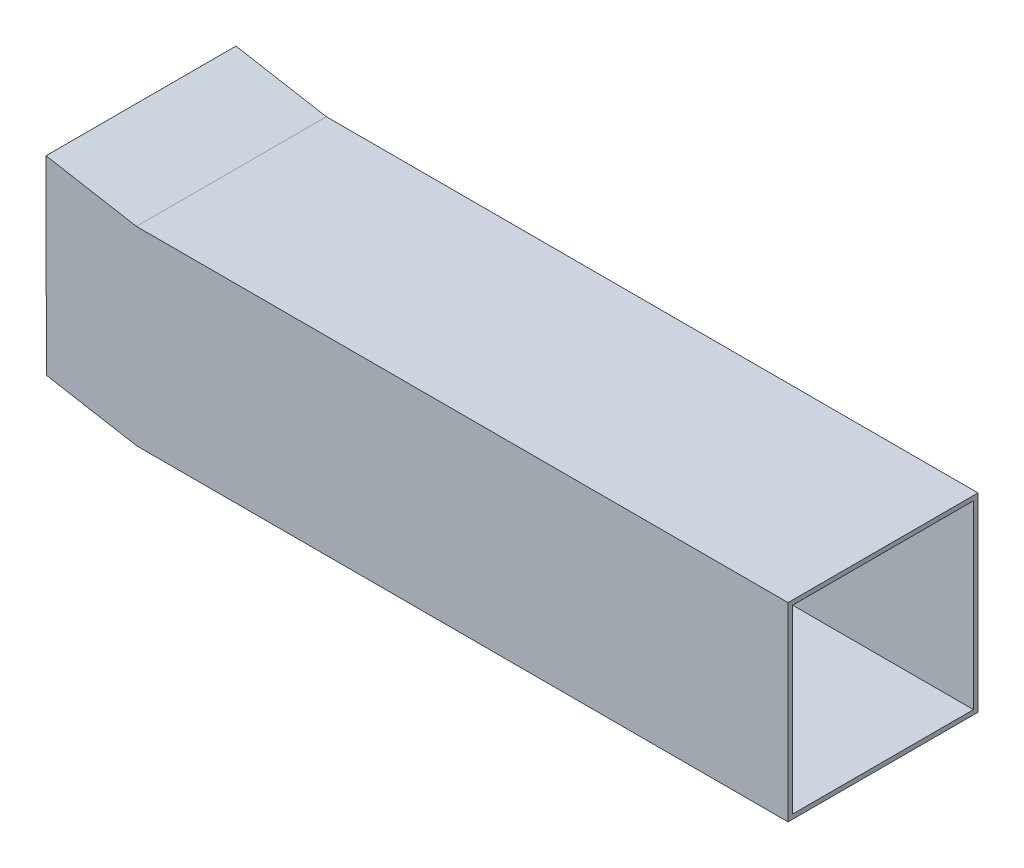
from build123d import *

# Parameters (mm, degrees)
SKETCH1_W           = 820
SKETCH1_H           = 210
BOSS_EXTRUDE1_DEPTH = 210
CUT_EXTRUDE5_DEPTH  = 336
BOSS_EXTRUDE2_DEPTH = 210
BOSS_EXTRUDE3_DEPTH = 5
BOSS_EXTRUDE4_DEPTH = 5
SHELL2_START        = 5
SHELL2_DEPTH        = 200


# Read off the part's stored shape, not the designer's step: Shell2
with BuildPart() as part:
    # Sketch1 → Boss-Extrude1 (new body)
    with BuildSketch(Plane.XY):
        Rectangle(SKETCH1_W, SKETCH1_H)
    extrude(amount=BOSS_EXTRUDE1_DEPTH)

    # Sketch2 → Cut-Extrude5 (cut)
    with BuildSketch(Plane.XY.offset(210)):
        Polygon((-409.131759112, -82.443263164), (-310, -99.922866941), (-310, 99.822096903), (-310.868240888, 100.075961235), (-338.793852416, 105), (-410, 105), (-410, -82.367301929), align=None)
        Polygon((-410, -105), (-310, -105), (-410, -87.367301929), align=None)
    extrude(amount=-CUT_EXTRUDE5_DEPTH, mode=Mode.SUBTRACT)

    # Sketch6 → Boss-Extrude2 (add, through all)
    with BuildSketch(Plane.XY.offset(210)):
        Polygon((-338.793852416, 105), (-310.434120444, 105), (-410.434120444, 122.632698071), (-410.434120444, 117.555565011), (-311.302361333, 100.075961235), (-310.434120444, 99.437059413), (-310.434120444, 99.949029069), (-310.868240888, 100.075961235), align=None)
    extrude(amount=-BOSS_EXTRUDE2_DEPTH)

    # Sketch8 → Boss-Extrude3 (add)
    with BuildSketch(Plane.XY.offset(210)):
        Polygon((-410, -87.367301929), (-310, -105), (410, -105), (410, 105), (-310.434120444, 105), (-410.434120444, 122.632698071), align=None)
    extrude(amount=-BOSS_EXTRUDE3_DEPTH)

    # Sketch9 → Boss-Extrude4 (add)
    with BuildSketch(Plane(origin=(0, 0, 0), x_dir=(-1, 0, 0), z_dir=(0, 0, -1))):
        Polygon((310.434120444, 105), (310, -105), (410, -87.367301929), (410.434120444, 122.632698071), align=None)
    extrude(amount=-BOSS_EXTRUDE4_DEPTH)

    # Shell2 outline → Shell2 (cut)
    with BuildSketch(Plane.XY.offset(SHELL2_START)):
        Polygon((410, 100), (-310, 100), (-310, -99.922866941), (-309.562556682, -100), (410, -100), align=None)
    extrude(amount=SHELL2_DEPTH, mode=Mode.SUBTRACT)


solid = part.part
